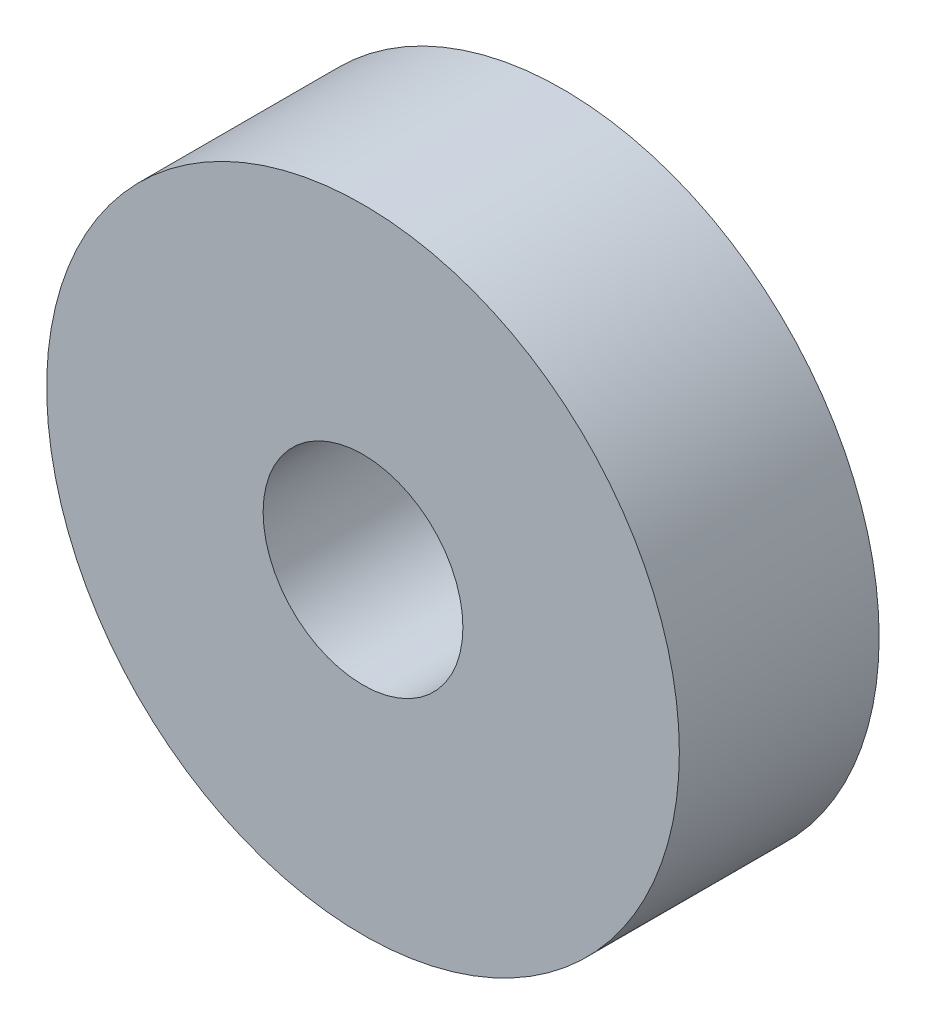
from build123d import *

# Parameters (mm, degrees)
SKETCH1_R           = 9.5
SKETCH1_R_2         = 3
BOSS_EXTRUDE1_DEPTH = 3


with BuildPart() as part:
    # Sketch1 → Boss-Extrude1 (new, symmetric)
    with BuildSketch(Plane.XY):
        Circle(SKETCH1_R)
        Circle(SKETCH1_R_2, mode=Mode.SUBTRACT)
    extrude(amount=BOSS_EXTRUDE1_DEPTH, both=True)


solid = part.part
